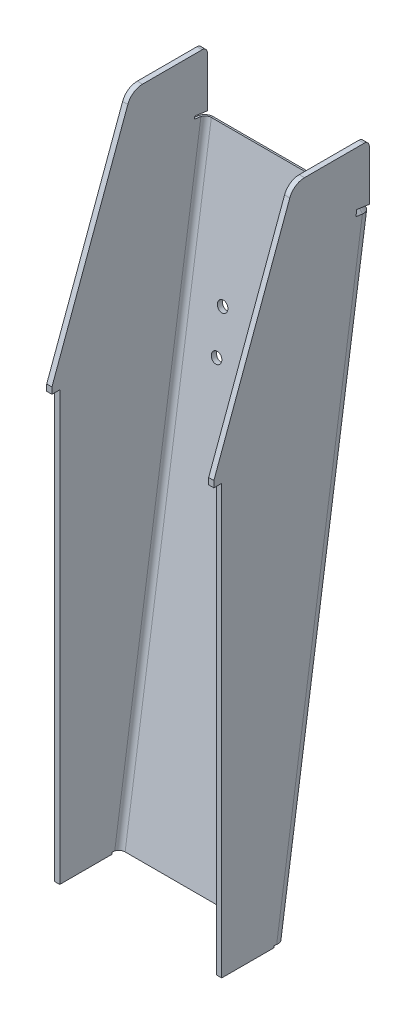
from build123d import *

# Parameters (mm, degrees)
BOSS_EXTRUDE1_DEPTH    = 101.6
BOSS_EXTRUDE2_DEPTH    = 6.35
CUT_EXTRUDE1_START     = 70.369117279
CUT_EXTRUDE1_OUTLINE_R = 6.35
CUT_EXTRUDE1_DEPTH     = 6.35
FLATTEN_BENDS1_START   = 128.994638868
FLATTEN_BENDS1_DEPTH   = 733.419948548
FLATTEN_BENDS1_START_2 = 859.239587416
FLATTEN_BENDS1_2_DEPTH = 3.175
FLATTEN_BENDS1_START_3 = 128.630782005
FLATTEN_BENDS1_3_DEPTH = 2.307819383
FLATTEN_BENDS1_START_4 = 130.938601388
FLATTEN_BENDS1_4_DEPTH = 728.300986028
CHAMFER1_SIZE          = 3.9624


# Read off the part's stored shape, not the designer's step: Cut-Extrude1, Flatten-Bends1
with BuildPart() as part:
    # Sketch11 → Boss-Extrude1 (new, symmetric)
    with BuildSketch(Plane(origin=(0, 0, 0), x_dir=(0, 0, -1), z_dir=(1, 0, 0))):
        Polygon((-57.083945563, 140.613525126), (-50.8, 139.7), (53.975, 860.425), (47.691054437, 861.338525126), align=None)
    extrude(amount=BOSS_EXTRUDE1_DEPTH, both=True)

    # Sketch8 → Boss-Extrude2 (add)
    with BuildSketch(Plane(origin=(101.6, 0, 0), x_dir=(0, 0, -1), z_dir=(1, 0, 0))):
        with BuildLine():
            Line((-130.175, 139.7), (-57.216748776, 139.7))
            Line((-57.216748776, 139.7), (-57.083945563, 140.613525126))
            Line((-57.083945563, 140.613525126), (-50.8, 139.7))
            Line((-50.8, 139.7), (53.975, 860.425))
            Line((53.975, 860.425), (49.2125, 861.117345815))
            Line((49.2125, 861.117345815), (49.2125, 925.5125))
            ThreePointArc((49.2125, 925.5125), (47.352628061, 930.002628061), (42.8625, 931.8625))
            Line((42.8625, 931.8625), (-29.563705158, 931.8625))
            ThreePointArc((-29.563705158, 931.8625), (-40.468229819, 928.432802235), (-47.446326779, 919.378651382))
            Line((-47.446326779, 919.378651382), (-139.7, 668.12987028))
            Line((-139.7, 668.12987028), (-139.7, 660.4))
            Line((-139.7, 660.4), (-130.175, 660.4))
            Line((-130.175, 660.4), (-130.175, 139.7))
        make_face()
    boss_extrude2 = extrude(amount=-BOSS_EXTRUDE2_DEPTH)

    # Mirror1: Boss-Extrude2 across plane
    add(boss_extrude2.mirror(Plane(origin=(0, 0, 0), x_dir=(0, 0, 1), z_dir=(1, 0, 0))))

    # Cut-Extrude1 outline → Cut-Extrude1 (cut)
    with BuildSketch(Plane(origin=(0, 0, 0), x_dir=(1, 0, 0), z_dir=(0, 0.143862224560971, 0.989597726525465)).offset(CUT_EXTRUDE1_START)):
        with Locations((50.8, 638.938601388)):
            Circle(CUT_EXTRUDE1_OUTLINE_R)
        with Locations((50.8, 689.738601388)):
            Circle(CUT_EXTRUDE1_OUTLINE_R)
        with Locations((-50.8, 638.938601388)):
            Circle(CUT_EXTRUDE1_OUTLINE_R)
        with Locations((-50.8, 689.738601388)):
            Circle(CUT_EXTRUDE1_OUTLINE_R)
    extrude(amount=CUT_EXTRUDE1_DEPTH, mode=Mode.SUBTRACT)

    # Flatten-Bends1 outline → Flatten-Bends1 (cut)
    with BuildSketch(Plane(origin=(0, 0, 0), x_dir=(1, 0, 0), z_dir=(0, 0.989597726525465, -0.143862224560971)).offset(FLATTEN_BENDS1_START)):
        with BuildLine():
            ThreePointArc((-101.6, -83.069117279), (-97.880256121, -74.088861158), (-88.9, -70.369117279))
            Line((-88.9, -70.369117279), (-101.6, -70.369117279))
            Line((-101.6, -70.369117279), (-101.6, -83.069117279))
        make_face()
        with BuildLine():
            Line((101.6, -70.369117279), (88.9, -70.369117279))
            ThreePointArc((88.9, -70.369117279), (97.880256121, -74.088861158), (101.6, -83.069117279))
            Line((101.6, -83.069117279), (101.6, -70.369117279))
        make_face()
    extrude(amount=FLATTEN_BENDS1_DEPTH, mode=Mode.SUBTRACT)

    # Flatten-Bends1 2 outline → Flatten-Bends1 2 (cut)
    with BuildSketch(Plane(origin=(0, 0, 0), x_dir=(1, 0, 0), z_dir=(0, 0.989597726525465, -0.143862224560971)).offset(FLATTEN_BENDS1_START_2)):
        with BuildLine():
            Line((-101.6, -83.069117279), (-101.6, -91.05667886))
            Line((-101.6, -91.05667886), (-95.25, -91.05667886))
            Line((-95.25, -91.05667886), (-95.25, -76.719117279))
            Line((-95.25, -76.719117279), (95.25, -76.719117279))
            Line((95.25, -76.719117279), (95.25, -91.05667886))
            Line((95.25, -91.05667886), (101.6, -91.05667886))
            Line((101.6, -91.05667886), (101.6, -83.069117279))
            ThreePointArc((101.6, -83.069117279), (97.880256121, -74.088861158), (88.9, -70.369117279))
            Line((88.9, -70.369117279), (-88.9, -70.369117279))
            ThreePointArc((-88.9, -70.369117279), (-97.880256121, -74.088861158), (-101.6, -83.069117279))
        make_face()
    extrude(amount=FLATTEN_BENDS1_2_DEPTH, mode=Mode.SUBTRACT)

    # Flatten-Bends1 3 outline → Flatten-Bends1 3 (cut)
    with BuildSketch(Plane(origin=(0, 0, 0), x_dir=(1, 0, 0), z_dir=(0, 0.989597726525465, -0.143862224560971)).offset(FLATTEN_BENDS1_START_3)):
        with BuildLine():
            Line((-101.6, -83.069117279), (-101.6, -86.244117279))
            Line((-101.6, -86.244117279), (-95.25, -86.244117279))
            Line((-95.25, -86.244117279), (-95.25, -76.719117279))
            Line((-95.25, -76.719117279), (-99.898522628, -76.719117279))
            ThreePointArc((-99.898522628, -76.719117279), (-101.167257994, -79.782115406), (-101.6, -83.069117279))
        make_face()
        with BuildLine():
            Line((95.25, -76.719117279), (95.25, -86.244117279))
            Line((95.25, -86.244117279), (101.6, -86.244117279))
            Line((101.6, -86.244117279), (101.6, -83.069117279))
            ThreePointArc((101.6, -83.069117279), (101.167257994, -79.782115406), (99.898522628, -76.719117279))
            Line((99.898522628, -76.719117279), (95.25, -76.719117279))
        make_face()
    extrude(amount=FLATTEN_BENDS1_3_DEPTH, mode=Mode.SUBTRACT)

    # Flatten-Bends1 4 outline → Flatten-Bends1 4 (add)
    with BuildSketch(Plane(origin=(0, 0, 0), x_dir=(1, 0, 0), z_dir=(0, 0.989597726525465, -0.143862224560971)).offset(FLATTEN_BENDS1_START_4)):
        with BuildLine():
            Line((-95.25, -76.719117279), (-95.25, -83.069117279))
            ThreePointArc((-95.25, -83.069117279), (-93.390128061, -78.578989218), (-88.9, -76.719117279))
            Line((-88.9, -76.719117279), (-95.25, -76.719117279))
        make_face()
        with BuildLine():
            Line((95.25, -76.719117279), (88.9, -76.719117279))
            ThreePointArc((88.9, -76.719117279), (93.390128061, -78.578989218), (95.25, -83.069117279))
            Line((95.25, -83.069117279), (95.25, -76.719117279))
        make_face()
    extrude(amount=FLATTEN_BENDS1_4_DEPTH)

    # Chamfer1
    chamfer1_edges = [part.edges().sort_by_distance(p)[0] for p in [
        (101.6, 862.826604441, -37.454872482),
        (0, 860.425, -53.975),
        (97.880256121, 860.960130629, -50.293949914),
        (-97.880256121, 860.960130629, -50.293949914),
        (-101.6, 862.826604441, -37.454872482),
    ]]
    chamfer(chamfer1_edges, length=CHAMFER1_SIZE)


solid = part.part
